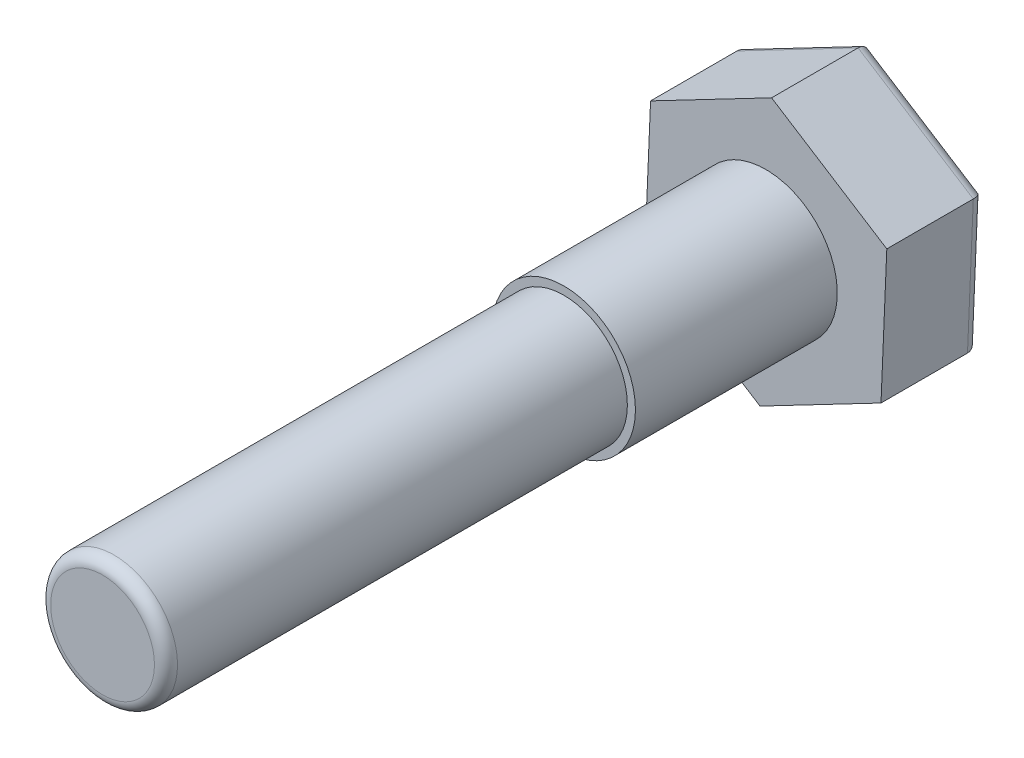
from build123d import *

# Parameters (mm, degrees)
EXTRUDE_372_DEPTH = 17
SKETCH_2_R        = 12.4
EXTRUDE_1_DEPTH   = 35
FILLET_3_R        = 2
SKETCH_3_R        = 11
EXTRUDE_2_DEPTH   = 80
FILLET_4_R        = 2


with BuildPart() as part:
    # 草图1 → Extrude 372 (new body)
    with BuildSketch(Plane.XY):
        Polygon((20.984201837, 10.954296262), (1.005402075, 23.65), (-19.978799762, 12.695703738), (-20.984201837, -10.954296262), (-1.005402075, -23.65), (19.978799762, -12.695703738), align=None)
    extrude(amount=EXTRUDE_372_DEPTH)

    # 草图2 → 凸台-拉伸1 (add)
    with BuildSketch(Plane.XY.offset(17)):
        Circle(SKETCH_2_R)
    extrude(amount=EXTRUDE_1_DEPTH)

    # 圆角3
    fillet_3_edges = [part.edges().sort_by_distance(p)[0] for p in [
        (10.994801956, 17.302148131, 0),
        (-9.486698843, 18.172851869, 0),
        (-20.4815008, 0.870703738, 0),
        (-10.994801956, -17.302148131, 0),
        (9.486698843, -18.172851869, 0),
        (20.4815008, -0.870703738, 0),
    ]]
    fillet(fillet_3_edges, radius=FILLET_3_R)

    # 草图3 → 凸台-拉伸2 (add)
    with BuildSketch(Plane.XY.offset(52)):
        Circle(SKETCH_3_R)
    extrude(amount=EXTRUDE_2_DEPTH)

    # 圆角4
    fillet_4_edges = [part.edges().sort_by_distance(p)[0] for p in [
        (-11, 0, 132),
    ]]
    fillet(fillet_4_edges, radius=FILLET_4_R)


solid = part.part
